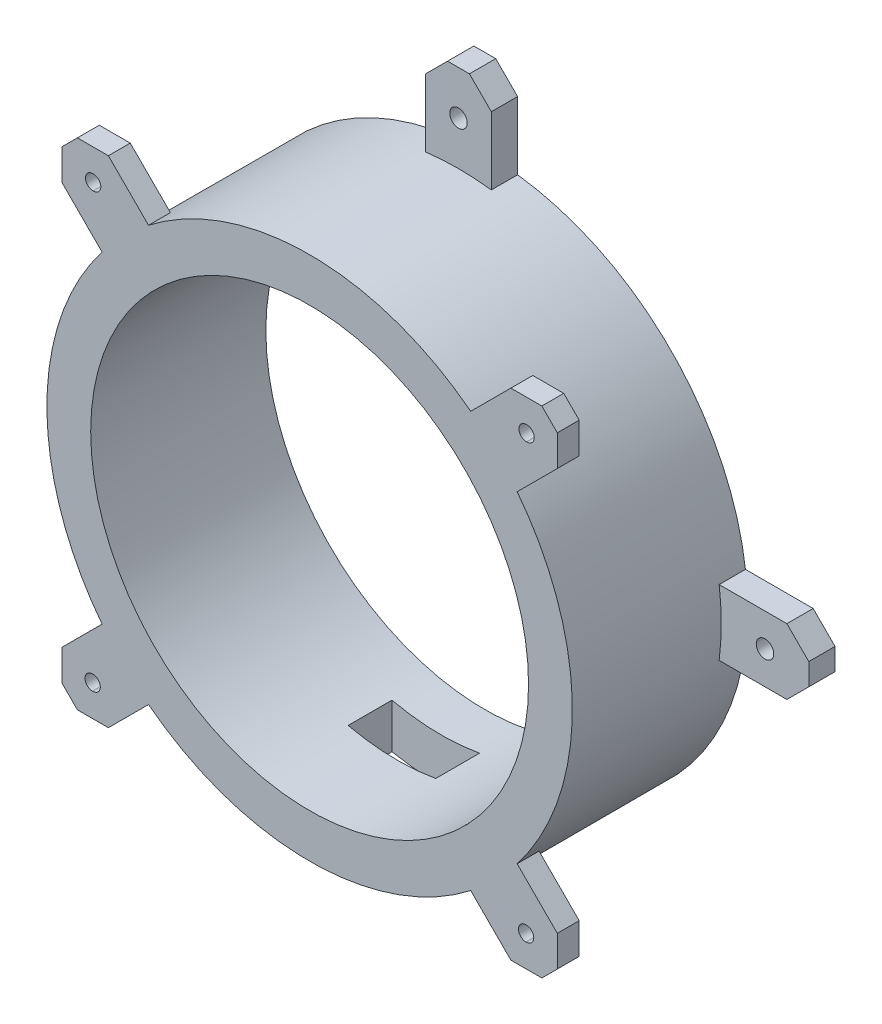
from build123d import *

# Parameters (mm, degrees)
SKETCH1_R                                      = 60
BOSS_EXTRUDE1_DEPTH                            = 40
BOSS_EXTRUDE2_DEPTH                            = 6
SKETCH2_R                                      = 50
CUT_EXTRUDE1_DEPTH                             = 42
BOSS_EXTRUDE4_START                            = -5
BOSS_EXTRUDE4_DEPTH                            = 5
CBORE_START                                    = 35
CBORE_SLOT_FOR_M3_HEX_HEAD_MACHINE_SCREW_DEPTH = 2.3
CBORE_START_2                                  = 37.3
CBORE_SLOT_FOR_M3_HEX_HEAD_MACHINE_S_3_DEPTH   = 2.7
F_4_0MM_DOWEL_HOLE1_D                          = 4
F_4_0MM_DOWEL_HOLE1_CSINK_D                    = 4.05
F_4_0MM_DOWEL_HOLE1_CSINK_ANGLE                = 90
SKETCH33_W                                     = 20
SKETCH33_H                                     = 10
CUT_EXTRUDE3_DEPTH                             = 121


with BuildPart() as part:
    # Sketch1 → Boss-Extrude1 (new body)
    with BuildSketch(Plane.XY):
        Circle(SKETCH1_R)
    extrude(amount=BOSS_EXTRUDE1_DEPTH)

    # Sketch1<6> → Boss-Extrude2 (add)
    with BuildSketch(Plane.XY):
        with BuildLine():
            Line((-7.5, 75), (-7.5, 59.529404499))
            ThreePointArc((-7.5, 59.529404499), (0, 60), (7.5, 59.529404499))
            Line((7.5, 59.529404499), (7.5, 75))
            Line((7.5, 75), (2.5, 80))
            Line((2.5, 80), (-2.5, 80))
            Line((-2.5, 80), (-7.5, 75))
        make_face()
        with BuildLine():
            Line((-59.529404499, 7.5), (-75, 7.5))
            Line((-75, 7.5), (-80, 2.5))
            Line((-80, 2.5), (-80, -2.5))
            Line((-80, -2.5), (-75, -7.5))
            Line((-75, -7.5), (-59.529404499, -7.5))
            ThreePointArc((-59.529404499, -7.5), (-60, 0), (-59.529404499, 7.5))
        make_face()
        with BuildLine():
            ThreePointArc((7.5, -59.529404499), (0, -60), (-7.5, -59.529404499))
            Line((-7.5, -59.529404499), (-7.5, -75))
            Line((-7.5, -75), (-2.5, -80))
            Line((-2.5, -80), (2.5, -80))
            Line((2.5, -80), (7.5, -75))
            Line((7.5, -75), (7.5, -59.529404499))
        make_face()
        with BuildLine():
            Line((75, 7.5), (59.529404499, 7.5))
            ThreePointArc((59.529404499, 7.5), (59.882235554, 3.757374753), (60, 0))
            ThreePointArc((60, 0), (59.882235554, -3.757374753), (59.529404499, -7.5))
            Line((59.529404499, -7.5), (75, -7.5))
            Line((75, -7.5), (80, -2.5))
            Line((80, -2.5), (80, 2.5))
            Line((80, 2.5), (75, 7.5))
        make_face()
    extrude(amount=BOSS_EXTRUDE2_DEPTH)

    # Sketch2 → Cut-Extrude1 (cut)
    with BuildSketch(Plane(origin=(0, 0, 0), x_dir=(-1, 0, 0), z_dir=(0, 0, -1))):
        Circle(SKETCH2_R)
    extrude(amount=-CUT_EXTRUDE1_DEPTH, mode=Mode.SUBTRACT)

    # Sketch4 → Boss-Extrude4 (add)
    with BuildSketch(Plane.XY.offset(40).offset(BOSS_EXTRUDE4_START)):
        with BuildLine():
            Line((53.033008589, 56.568542495), (45.961940777, 56.568542495))
            Line((45.961940777, 56.568542495), (36.790344742, 47.39694646))
            ThreePointArc((36.790344742, 47.39694646), (42.426406871, 42.426406871), (47.39694646, 36.790344742))
            Line((47.39694646, 36.790344742), (56.568542495, 45.961940777))
            Line((56.568542495, 45.961940777), (56.568542495, 53.033008589))
            Line((56.568542495, 53.033008589), (53.033008589, 56.568542495))
        make_face()
        with BuildLine():
            ThreePointArc((-47.39694646, 36.790344742), (-42.426406871, 42.426406871), (-36.790344742, 47.39694646))
            Line((-36.790344742, 47.39694646), (-45.961940777, 56.568542495))
            Line((-45.961940777, 56.568542495), (-53.033008589, 56.568542495))
            Line((-53.033008589, 56.568542495), (-56.568542495, 53.033008589))
            Line((-56.568542495, 53.033008589), (-56.568542495, 45.961940777))
            Line((-56.568542495, 45.961940777), (-47.39694646, 36.790344742))
        make_face()
        with BuildLine():
            Line((56.568542495, -45.961940777), (47.39694646, -36.790344742))
            ThreePointArc((47.39694646, -36.790344742), (42.426406871, -42.426406871), (36.790344742, -47.39694646))
            Line((36.790344742, -47.39694646), (45.961940777, -56.568542495))
            Line((45.961940777, -56.568542495), (53.033008589, -56.568542495))
            Line((53.033008589, -56.568542495), (56.568542495, -53.033008589))
            Line((56.568542495, -53.033008589), (56.568542495, -45.961940777))
        make_face()
        with BuildLine():
            ThreePointArc((-36.790344742, -47.39694646), (-42.426406871, -42.426406871), (-47.39694646, -36.790344742))
            Line((-47.39694646, -36.790344742), (-56.568542495, -45.961940777))
            Line((-56.568542495, -45.961940777), (-56.568542495, -53.033008589))
            Line((-56.568542495, -53.033008589), (-53.033008589, -56.568542495))
            Line((-53.033008589, -56.568542495), (-45.961940777, -56.568542495))
            Line((-45.961940777, -56.568542495), (-36.790344742, -47.39694646))
        make_face()
    extrude(amount=BOSS_EXTRUDE4_DEPTH)

    # CBORE SLOT for M3 Hex Head Machine Screw6: read off the stored shape, not the designer's step
    # CBORE SLOT for M3 Hex Head Machine S 2 → CBORE SLOT for M3 Hex Head Machine Screw6 (cut)
    with BuildSketch(Plane.XY.offset(CBORE_START)):
        with BuildLine():
            ThreePointArc((49.489276654, -53.755604364), (53.689276654, -49.555604364), (49.489276654, -45.355604364))
            Line((49.489276654, -45.355604364), (49.389276654, -45.355604364))
            ThreePointArc((49.389276654, -45.355604364), (45.189276654, -49.555604364), (49.389276654, -53.755604364))
            Line((49.389276654, -53.755604364), (49.489276654, -53.755604364))
        make_face()
        with BuildLine():
            ThreePointArc((-49.505604364, -53.639276654), (-45.305604364, -49.439276654), (-49.505604364, -45.239276654))
            Line((-49.505604364, -45.239276654), (-49.605604364, -45.239276654))
            ThreePointArc((-49.605604364, -45.239276654), (-53.805604364, -49.439276654), (-49.605604364, -53.639276654))
            Line((-49.605604364, -53.639276654), (-49.505604364, -53.639276654))
        make_face()
        with BuildLine():
            ThreePointArc((-49.389276654, 45.355604364), (-45.189276654, 49.555604364), (-49.389276654, 53.755604364))
            Line((-49.389276654, 53.755604364), (-49.489276654, 53.755604364))
            ThreePointArc((-49.489276654, 53.755604364), (-53.689276654, 49.555604364), (-49.489276654, 45.355604364))
            Line((-49.489276654, 45.355604364), (-49.389276654, 45.355604364))
        make_face()
        with BuildLine():
            ThreePointArc((49.605604364, 45.239276654), (53.805604364, 49.439276654), (49.605604364, 53.639276654))
            Line((49.605604364, 53.639276654), (49.505604364, 53.639276654))
            ThreePointArc((49.505604364, 53.639276654), (45.305604364, 49.439276654), (49.505604364, 45.239276654))
            Line((49.505604364, 45.239276654), (49.605604364, 45.239276654))
        make_face()
    extrude(amount=CBORE_SLOT_FOR_M3_HEX_HEAD_MACHINE_SCREW_DEPTH, mode=Mode.SUBTRACT)

    # CBORE SLOT for M3 Hex Head Machine S 3 o → CBORE SLOT for M3 Hex Head Machine S 3 (cut)
    with BuildSketch(Plane.XY.offset(CBORE_START_2)):
        with BuildLine():
            ThreePointArc((49.489276654, -51.255604364), (51.189276654, -49.555604364), (49.489276654, -47.855604364))
            Line((49.489276654, -47.855604364), (49.389276654, -47.855604364))
            ThreePointArc((49.389276654, -47.855604364), (47.689276654, -49.555604364), (49.389276654, -51.255604364))
            Line((49.389276654, -51.255604364), (49.489276654, -51.255604364))
        make_face()
        with BuildLine():
            ThreePointArc((-49.505604364, -51.139276654), (-47.805604364, -49.439276654), (-49.505604364, -47.739276654))
            Line((-49.505604364, -47.739276654), (-49.605604364, -47.739276654))
            ThreePointArc((-49.605604364, -47.739276654), (-51.305604364, -49.439276654), (-49.605604364, -51.139276654))
            Line((-49.605604364, -51.139276654), (-49.505604364, -51.139276654))
        make_face()
        with BuildLine():
            ThreePointArc((-49.389276654, 47.855604364), (-47.689276654, 49.555604364), (-49.389276654, 51.255604364))
            Line((-49.389276654, 51.255604364), (-49.489276654, 51.255604364))
            ThreePointArc((-49.489276654, 51.255604364), (-51.189276654, 49.555604364), (-49.489276654, 47.855604364))
            Line((-49.489276654, 47.855604364), (-49.389276654, 47.855604364))
        make_face()
        with BuildLine():
            ThreePointArc((49.605604364, 47.739276654), (51.305604364, 49.439276654), (49.605604364, 51.139276654))
            Line((49.605604364, 51.139276654), (49.505604364, 51.139276654))
            ThreePointArc((49.505604364, 51.139276654), (47.805604364, 49.439276654), (49.505604364, 47.739276654))
            Line((49.505604364, 47.739276654), (49.605604364, 47.739276654))
        make_face()
    extrude(amount=CBORE_SLOT_FOR_M3_HEX_HEAD_MACHINE_S_3_DEPTH, mode=Mode.SUBTRACT)

    # CBORE SLOT for M3 Hex Head Machine S 4: loft between two sections, ruled curve by curve
    cbore_slot_for_m3_hex_head_machine_s_4_from = [
        Edge.make_three_point_arc((49.489276654, -45.355604364, 35.025), (52.459125135, -46.585755883, 35.025), (53.689276654, -49.555604364, 35.025)),
        Edge.make_three_point_arc((53.689276654, -49.555604364, 35.025), (52.459125135, -52.525452845, 35.025), (49.489276654, -53.755604364, 35.025)),
        Edge.make_three_point_arc((49.389276654, -53.755604364, 35.025), (46.419428173, -52.525452845, 35.025), (45.189276654, -49.555604364, 35.025)),
        Edge.make_three_point_arc((45.189276654, -49.555604364, 35.025), (46.419428173, -46.585755883, 35.025), (49.389276654, -45.355604364, 35.025)),
        Edge.make_line((49.489276654, -53.755604364, 35.025), (49.389276654, -53.755604364, 35.025)),
        Edge.make_line((49.489276654, -45.355604364, 35.025), (49.389276654, -45.355604364, 35.025)),
    ]
    cbore_slot_for_m3_hex_head_machine_s_4_to = [
        Edge.make_three_point_arc((49.489276654, -45.330604364, 35), (52.476802805, -46.568078214, 35), (53.714276654, -49.555604364, 35)),
        Edge.make_three_point_arc((53.714276654, -49.555604364, 35), (52.476802805, -52.543130515, 35), (49.489276654, -53.780604364, 35)),
        Edge.make_three_point_arc((49.389276654, -53.780604364, 35), (46.401750504, -52.543130515, 35), (45.164276654, -49.555604364, 35)),
        Edge.make_three_point_arc((45.164276654, -49.555604364, 35), (46.401750504, -46.568078214, 35), (49.389276654, -45.330604364, 35)),
        Edge.make_line((49.489276654, -53.780604364, 35), (49.389276654, -53.780604364, 35)),
        Edge.make_line((49.489276654, -45.330604364, 35), (49.389276654, -45.330604364, 35)),
    ]
    cbore_slot_for_m3_hex_head_machine_s_4 = Solid(Shell([*[Face.make_surface_from_curves(cbore_slot_for_m3_hex_head_machine_s_4_from[k], cbore_slot_for_m3_hex_head_machine_s_4_to[k]) for k in range(6)], Face(Wire(cbore_slot_for_m3_hex_head_machine_s_4_from)), Face(Wire(cbore_slot_for_m3_hex_head_machine_s_4_to))]))
    add(cbore_slot_for_m3_hex_head_machine_s_4, mode=Mode.SUBTRACT)

    # CBORE SLOT for M3 Hex Head Machine S 5: loft between two sections, ruled curve by curve
    cbore_slot_for_m3_hex_head_machine_s_5_from = [
        Edge.make_three_point_arc((-49.505604364, -45.239276654, 35.025), (-46.535755883, -46.469428173, 35.025), (-45.305604364, -49.439276654, 35.025)),
        Edge.make_three_point_arc((-45.305604364, -49.439276654, 35.025), (-46.535755883, -52.409125135, 35.025), (-49.505604364, -53.639276654, 35.025)),
        Edge.make_three_point_arc((-49.605604364, -53.639276654, 35.025), (-52.575452845, -52.409125135, 35.025), (-53.805604364, -49.439276654, 35.025)),
        Edge.make_three_point_arc((-53.805604364, -49.439276654, 35.025), (-52.575452845, -46.469428173, 35.025), (-49.605604364, -45.239276654, 35.025)),
        Edge.make_line((-49.505604364, -53.639276654, 35.025), (-49.605604364, -53.639276654, 35.025)),
        Edge.make_line((-49.505604364, -45.239276654, 35.025), (-49.605604364, -45.239276654, 35.025)),
    ]
    cbore_slot_for_m3_hex_head_machine_s_5_to = [
        Edge.make_three_point_arc((-49.505604364, -45.214276654, 35), (-46.518078214, -46.451750504, 35), (-45.280604364, -49.439276654, 35)),
        Edge.make_three_point_arc((-45.280604364, -49.439276654, 35), (-46.518078214, -52.426802805, 35), (-49.505604364, -53.664276654, 35)),
        Edge.make_three_point_arc((-49.605604364, -53.664276654, 35), (-52.593130515, -52.426802805, 35), (-53.830604364, -49.439276654, 35)),
        Edge.make_three_point_arc((-53.830604364, -49.439276654, 35), (-52.593130515, -46.451750504, 35), (-49.605604364, -45.214276654, 35)),
        Edge.make_line((-49.505604364, -53.664276654, 35), (-49.605604364, -53.664276654, 35)),
        Edge.make_line((-49.505604364, -45.214276654, 35), (-49.605604364, -45.214276654, 35)),
    ]
    cbore_slot_for_m3_hex_head_machine_s_5 = Solid(Shell([*[Face.make_surface_from_curves(cbore_slot_for_m3_hex_head_machine_s_5_from[k], cbore_slot_for_m3_hex_head_machine_s_5_to[k]) for k in range(6)], Face(Wire(cbore_slot_for_m3_hex_head_machine_s_5_from)), Face(Wire(cbore_slot_for_m3_hex_head_machine_s_5_to))]))
    add(cbore_slot_for_m3_hex_head_machine_s_5, mode=Mode.SUBTRACT)

    # CBORE SLOT for M3 Hex Head Machine S 6: loft between two sections, ruled curve by curve
    cbore_slot_for_m3_hex_head_machine_s_6_from = [
        Edge.make_three_point_arc((-49.389276654, 53.755604364, 35.025), (-46.419428173, 52.525452845, 35.025), (-45.189276654, 49.555604364, 35.025)),
        Edge.make_three_point_arc((-45.189276654, 49.555604364, 35.025), (-46.419428173, 46.585755883, 35.025), (-49.389276654, 45.355604364, 35.025)),
        Edge.make_three_point_arc((-49.489276654, 45.355604364, 35.025), (-52.459125135, 46.585755883, 35.025), (-53.689276654, 49.555604364, 35.025)),
        Edge.make_three_point_arc((-53.689276654, 49.555604364, 35.025), (-52.459125135, 52.525452845, 35.025), (-49.489276654, 53.755604364, 35.025)),
        Edge.make_line((-49.389276654, 45.355604364, 35.025), (-49.489276654, 45.355604364, 35.025)),
        Edge.make_line((-49.389276654, 53.755604364, 35.025), (-49.489276654, 53.755604364, 35.025)),
    ]
    cbore_slot_for_m3_hex_head_machine_s_6_to = [
        Edge.make_three_point_arc((-49.389276654, 53.780604364, 35), (-46.401750504, 52.543130515, 35), (-45.164276654, 49.555604364, 35)),
        Edge.make_three_point_arc((-45.164276654, 49.555604364, 35), (-46.401750504, 46.568078214, 35), (-49.389276654, 45.330604364, 35)),
        Edge.make_three_point_arc((-49.489276654, 45.330604364, 35), (-52.476802805, 46.568078214, 35), (-53.714276654, 49.555604364, 35)),
        Edge.make_three_point_arc((-53.714276654, 49.555604364, 35), (-52.476802805, 52.543130515, 35), (-49.489276654, 53.780604364, 35)),
        Edge.make_line((-49.389276654, 45.330604364, 35), (-49.489276654, 45.330604364, 35)),
        Edge.make_line((-49.389276654, 53.780604364, 35), (-49.489276654, 53.780604364, 35)),
    ]
    cbore_slot_for_m3_hex_head_machine_s_6 = Solid(Shell([*[Face.make_surface_from_curves(cbore_slot_for_m3_hex_head_machine_s_6_from[k], cbore_slot_for_m3_hex_head_machine_s_6_to[k]) for k in range(6)], Face(Wire(cbore_slot_for_m3_hex_head_machine_s_6_from)), Face(Wire(cbore_slot_for_m3_hex_head_machine_s_6_to))]))
    add(cbore_slot_for_m3_hex_head_machine_s_6, mode=Mode.SUBTRACT)

    # CBORE SLOT for M3 Hex Head Machine S 7: loft between two sections, ruled curve by curve
    cbore_slot_for_m3_hex_head_machine_s_7_from = [
        Edge.make_three_point_arc((49.605604364, 53.639276654, 35.025), (52.575452845, 52.409125135, 35.025), (53.805604364, 49.439276654, 35.025)),
        Edge.make_three_point_arc((53.805604364, 49.439276654, 35.025), (52.575452845, 46.469428173, 35.025), (49.605604364, 45.239276654, 35.025)),
        Edge.make_three_point_arc((49.505604364, 45.239276654, 35.025), (46.535755883, 46.469428173, 35.025), (45.305604364, 49.439276654, 35.025)),
        Edge.make_three_point_arc((45.305604364, 49.439276654, 35.025), (46.535755883, 52.409125135, 35.025), (49.505604364, 53.639276654, 35.025)),
        Edge.make_line((49.605604364, 45.239276654, 35.025), (49.505604364, 45.239276654, 35.025)),
        Edge.make_line((49.605604364, 53.639276654, 35.025), (49.505604364, 53.639276654, 35.025)),
    ]
    cbore_slot_for_m3_hex_head_machine_s_7_to = [
        Edge.make_three_point_arc((49.605604364, 53.664276654, 35), (52.593130515, 52.426802805, 35), (53.830604364, 49.439276654, 35)),
        Edge.make_three_point_arc((53.830604364, 49.439276654, 35), (52.593130515, 46.451750504, 35), (49.605604364, 45.214276654, 35)),
        Edge.make_three_point_arc((49.505604364, 45.214276654, 35), (46.518078214, 46.451750504, 35), (45.280604364, 49.439276654, 35)),
        Edge.make_three_point_arc((45.280604364, 49.439276654, 35), (46.518078214, 52.426802805, 35), (49.505604364, 53.664276654, 35)),
        Edge.make_line((49.605604364, 45.214276654, 35), (49.505604364, 45.214276654, 35)),
        Edge.make_line((49.605604364, 53.664276654, 35), (49.505604364, 53.664276654, 35)),
    ]
    cbore_slot_for_m3_hex_head_machine_s_7 = Solid(Shell([*[Face.make_surface_from_curves(cbore_slot_for_m3_hex_head_machine_s_7_from[k], cbore_slot_for_m3_hex_head_machine_s_7_to[k]) for k in range(6)], Face(Wire(cbore_slot_for_m3_hex_head_machine_s_7_from)), Face(Wire(cbore_slot_for_m3_hex_head_machine_s_7_to))]))
    add(cbore_slot_for_m3_hex_head_machine_s_7, mode=Mode.SUBTRACT)

    # Ø4.0mm Dowel Hole1 (through all)
    with Locations(Plane(origin=(0, 0, 0), x_dir=(-1, 0, 0), z_dir=(0, 0, -1))):
        with Locations((0, 70), (70, 0), (0, -70), (-70, 0)):
            CounterSinkHole(F_4_0MM_DOWEL_HOLE1_D / 2, F_4_0MM_DOWEL_HOLE1_CSINK_D / 2, counter_sink_angle=F_4_0MM_DOWEL_HOLE1_CSINK_ANGLE)

    # Sketch33 → Cut-Extrude3 (cut, through all)
    with BuildSketch(Plane(origin=(0, 0, 0), x_dir=(1, 0, 0), z_dir=(0, 1, 0))):
        with Locations((-1.199431059, -15)):
            Rectangle(SKETCH33_W, SKETCH33_H)
    extrude(amount=-CUT_EXTRUDE3_DEPTH, mode=Mode.SUBTRACT)


solid = part.part
